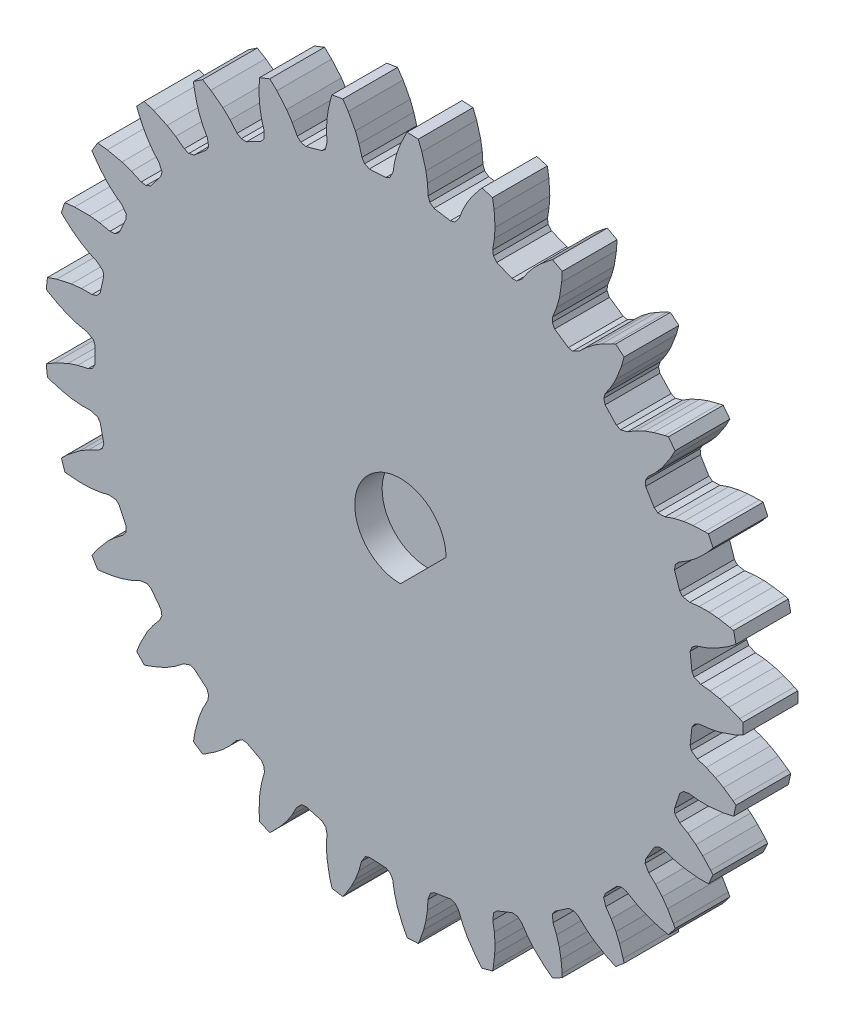
from build123d import *

# Parameters (mm, degrees)
BOSS_EXTRUDE1_DEPTH = 6
CUT_EXTRUDE1_DEPTH  = 3


with BuildPart() as part:
    # Sketch2 → Boss-Extrude1 (new body)
    with BuildSketch(Plane.XY):
        Polygon((13.434896137, 30.085511597), (12.943917266, 30.086396982), (11.264530778, 30.755525717), (10.899750384, 31.191462351), (10.826172203, 31.731935444), (11.005641062, 32.886905725), (11.077014093, 33.985331061), (10.978925225, 35.629670245), (10.806166971, 36.685335009), (9.647161448, 37.007131295), (9.375505101, 36.699837582), (8.593149777, 35.69545855), (8.032491986, 34.836488949), (7.526554726, 33.856954531), (7.15190235, 32.895155464), (6.653300303, 32.270234999), (6.173609914, 32.16555374), (4.389643649, 32.458020164), (3.939678129, 32.805347841), (3.751634426, 33.317367838), (3.678622933, 34.483916056), (3.512198324, 35.57200391), (3.062918401, 37.15681315), (2.667262419, 38.150659141), (1.466177112, 38.215780081), (1.266931005, 37.85727264), (0.718778516, 36.708192163), (0.355881666, 35.748779943), (0.072343883, 34.683384939), (-0.08679096, 33.663533013), (-0.43939654, 32.94603814), (-0.885368659, 32.740685017), (-2.690498419, 32.642813725), (-3.204609179, 32.885291788), (-3.498325689, 33.344917205), (-3.820403598, 34.468496861), (-4.216844017, 35.495369454), (-4.996307165, 36.946544832), (-5.59636044, 37.832100915), (-6.783364117, 37.637501527), (-6.900883459, 37.244543766), (-7.189202111, 36.004491571), (-7.337369367, 34.989497779), (-7.385249761, 33.888058877), (-7.321426103, 32.857841235), (-7.511547771, 32.081321216), (-7.902948459, 31.784898312), (-9.644835854, 31.301265658), (-10.199052606, 31.427556102), (-10.584708065, 31.813295365), (-11.140792385, 32.841369123), (-11.7487115, 33.759011034), (-12.821911043, 35.008697202), (-13.598303787, 35.744555759), (-14.715722862, 35.299335294), (-14.746020364, 34.890301483), (-14.76102372, 33.617261031), (-14.687533245, 32.59414565), (-14.497517417, 31.508164908), (-14.21371958, 30.515753382), (-14.232467459, 29.71651743), (-14.550995254, 29.342885151), (-16.148191565, 28.496105259), (-16.71659975, 28.500302884), (-17.176161338, 28.794119253), (-17.940250184, 29.678615527), (-18.731222373, 30.44411884), (-20.047976693, 31.433881862), (-20.964405644, 31.985634966), (-21.959990842, 31.310611437), (-21.901649827, 30.904627541), (-21.642636347, 29.65812479), (-21.350924475, 28.674727558), (-20.931897352, 27.654984228), (-20.441395409, 26.746782878), (-20.287892869, 25.962202379), (-20.518653765, 25.528831355), (-21.896475868, 24.358498712), (-22.45249735, 24.240407241), (-22.964476478, 24.42856219), (-23.900841905, 25.128122917), (-24.837882188, 25.705693548), (-26.336621316, 26.389253205), (-27.350235275, 26.731101492), (-28.17743414, 25.85783825), (-28.033182569, 25.473887626), (-27.512263434, 24.312207659), (-27.015970288, 23.414511137), (-26.387525114, 22.508687284), (-25.713254389, 21.727162595), (-25.394679039, 20.993923661), (-25.526882913, 20.52107784), (-26.620905378, 19.0819159), (-27.138541211, 18.847057158), (-27.678998304, 18.92075277), (-28.743856904, 19.402667268), (-29.78315032, 19.765298658), (-31.39379488, 20.110692459), (-32.457198385, 20.226651485), (-33.077332016, 19.195981347), (-32.853914932, 18.8520171), (-32.095447743, 17.82947878), (-31.417779438, 17.05945826), (-30.609301611, 16.309909201), (-29.782790255, 15.6916044), (-29.314038322, 15.043992468), (-29.341503469, 14.553781594), (-30.100571021, 12.91308397), (-30.555617129, 12.572439692), (-31.099281013, 12.528230043), (-32.242841183, 12.769964525), (-33.335791526, 12.900700431), (-34.983029569, 12.891778147), (-36.046499053, 12.776425796), (-36.430570691, 11.636541754), (-36.138434829, 11.348647268), (-35.177884669, 10.513063351), (-34.350528222, 9.906724137), (-33.399821266, 9.348497953), (-32.459716031, 8.922324285), (-31.862705836, 8.390620969), (-31.784148016, 7.905966758), (-32.172767499, 6.140450647), (-32.543946432, 5.709948981), (-33.065395989, 5.549901264), (-34.234186126, 5.540152496), (-35.329688252, 5.432879852), (-36.936496757, 5.07005868), (-37.95030557, 4.728788699), (-38.080356453, 3.532990463), (-37.73316176, 3.314627365), (-36.615442887, 2.705068827), (-35.677084566, 2.290762666), (-34.628602482, 1.949961393), (-33.618861644, 1.735846265), (-32.92150872, 1.344913421), (-32.740601208, 0.888477765), (-32.740601208, -0.919303262), (-33.010557051, -1.419532537), (-33.48540988, -1.687934667), (-34.624778656, -1.948710845), (-35.671608103, -2.288976088), (-37.162854492, -2.988731035), (-38.07959806, -3.539961241), (-37.949547152, -4.735759473), (-37.563528067, -4.874380767), (-36.340903772, -5.229411647), (-35.33542017, -5.432312259), (-34.238188815, -5.539753133), (-33.206026733, -5.531797936), (-32.440938527, -5.763680721), (-32.166140359, -6.170555398), (-31.777520876, -7.936071509), (-31.933630794, -8.482638228), (-32.339683303, -8.846844588), (-33.3963551, -9.346454571), (-34.345563288, -9.903801989), (-35.651518535, -10.907770947), (-36.428330949, -11.643186465), (-36.044259286, -12.783070498), (-35.637465632, -12.835468211), (-34.36710447, -12.919370583), (-33.341510881, -12.901378239), (-32.246835574, -12.770434897), (-31.240514999, -12.540781351), (-30.443466186, -12.602771498), (-30.087626618, -12.941060187), (-29.328559067, -14.581757812), (-29.363523534, -15.149105122), (-29.681789159, -15.592085826), (-30.606355179, -16.307168407), (-31.413558187, -17.055537053), (-32.473157278, -18.31677555), (-33.073715651, -19.201989168), (-32.453581998, -20.232659292), (-32.045034995, -20.196383364), (-30.78633764, -20.005234048), (-29.788589682, -19.767190049), (-28.747656222, -19.403985257), (-27.814231588, -18.963371707), (-27.022491284, -18.852570624), (-26.602248979, -19.106455323), (-25.508226515, -20.545617263), (-25.420410631, -21.107216636), (-25.636007625, -21.608258399), (-26.385236188, -22.50537711), (-27.012690101, -23.4097741), (-27.77638736, -24.869308024), (-28.17261025, -25.862928137), (-27.345411367, -26.736191362), (-26.954214218, -26.612938016), (-25.766035961, -26.15567494), (-24.842787219, -25.70870996), (-23.904268499, -25.13022677), (-23.087385703, -24.499255815), (-22.337974805, -24.220844439), (-21.872979825, -24.378453782), (-20.495157723, -25.548786424), (-20.288667661, -26.078378096), (-20.391514949, -26.614052762), (-20.930372961, -27.651259331), (-21.348738731, -28.669396065), (-21.780824521, -30.258979233), (-21.954184988, -31.31454527), (-20.958599775, -31.989568778), (-20.603044424, -31.785101203), (-19.540943159, -31.08310548), (-18.735363718, -30.448119105), (-17.94314383, -29.681406748), (-17.280999403, -28.889581889), (-16.608959532, -28.456578425), (-16.120954527, -28.510542774), (-14.523758216, -29.357322666), (-14.208249222, -29.830143519), (-14.19353778, -30.375403536), (-14.496828838, -31.504199336), (-14.686544146, -32.588468873), (-14.766814618, -34.233774142), (-14.709206518, -35.301929007), (-13.591787433, -35.747149449), (-13.288499253, -35.471028322), (-12.402137655, -34.557124493), (-11.751895514, -33.763807979), (-11.14301778, -32.844717073), (-10.666572861, -31.929063161), (-10.103327853, -31.36171437), (-9.615131395, -31.309510411), (-7.873243999, -31.793143066), (-7.463468924, -32.187084523), (-7.33188664, -32.716434139), (-7.385429192, -33.884037932), (-7.337623163, -34.983741033), (-7.062324957, -36.607835758), (-6.776441981, -37.638633717), (-5.589438299, -37.83323308), (-5.352598708, -37.498369519), (-4.68342206, -36.41529071), (-4.218921819, -35.500738656), (-3.821856685, -34.47224487), (-3.553389308, -33.475576863), (-3.125275875, -32.800411345), (-2.659715486, -32.644480078), (-0.854585726, -32.74235137), (-0.369705195, -33.038993166), (-0.127404713, -33.52768058), (0.071304833, -34.679496512), (0.354396843, -35.743212282), (0.972391088, -37.270155599), (1.47318137, -38.215397685), (2.674266676, -38.15027672), (2.833583322, -37.77232857), (3.254285063, -36.570718344), (3.511323889, -35.577694187), (3.678010099, -34.487888748), (3.725946698, -33.456809735), (3.998910448, -32.705397478), (4.420065681, -32.453030076), (6.204031945, -32.160563652), (6.741345456, -32.346035147), (7.083034436, -32.77120988), (7.52470464, -33.853380316), (8.029845565, -34.831370589), (8.961639124, -36.189764325), (9.653920315, -37.005252069), (10.812925831, -36.683455758), (10.887270063, -36.280095457), (11.039825352, -35.016139772), (11.077383913, -33.991076219), (11.005897137, -32.890917217), (10.831061495, -31.873639306), (10.936112081, -31.081115513), (11.293169407, -30.744112395), (12.972555895, -30.07498366), (13.537178204, -30.140612413), (13.962278685, -30.482393766), (14.62625754, -31.444317621), (15.32982755, -32.290852658), (16.531850793, -33.417179831), (17.383252594, -34.064781933), (18.445984511, -33.501357115), (18.431880074, -33.091445341), (18.309155595, -31.824245359), (18.125477694, -30.815073242), (17.819160575, -29.75600289), (17.429727813, -28.800092867), (17.361953185, -28.003515069), (17.638217001, -27.597634126), (19.134497468, -26.583130796), (19.700027463, -26.525848079), (20.188662219, -26.768254736), (21.043902812, -27.564953519), (21.913003755, -28.240450283), (23.329051411, -29.082045087), (24.29976322, -29.531480391), (25.216529374, -28.752772185), (25.114635777, -28.355475958), (24.72236999, -27.144284542), (24.326044202, -26.198191628), (23.799219787, -25.229730878), (23.213399348, -24.379886032), (22.975968574, -23.616501322), (23.15852109, -23.160721095), (24.401731124, -21.848280219), (24.94172525, -21.670764508), (25.471046263, -21.802461804), (26.477558495, -22.396682765), (27.471552178, -22.869555778), (29.035411432, -23.387066175), (30.080043847, -23.617319587), (30.807977284, -22.659739527), (30.623058961, -22.293635975), (29.979593791, -21.195087084), (29.389151878, -20.356311618), (28.6664539, -19.523744612), (27.911638105, -18.819702735), (27.51565319, -18.125206129), (27.595958459, -17.640838398), (28.527966957, -16.091828262), (29.017175693, -15.802379999), (29.5624325, -15.81720992), (30.673152973, -16.18116796), (31.745561353, -16.429306215), (33.384107883, -16.598534012), (34.453815046, -16.598839149), (34.958878396, -15.507162611), (34.699581919, -15.189370329), (33.835005067, -14.254830891), (33.078055428, -13.562593089), (32.193276431, -12.904849738), (31.304759617, -12.379531054), (30.768736368, -11.786396444), (30.7430394, -11.296089701), (31.320266666, -9.582940284), (31.735815154, -9.195093744), (32.271512155, -9.092362854), (33.43450482, -9.209039688), (34.535183278, -9.220840508), (36.171800475, -9.033872784), (37.216564075, -8.804215367), (37.475141137, -7.629487928), (37.153590921, -7.374866532), (36.108329042, -6.648034573), (35.220265799, -6.134702703), (34.214777066, -5.682538357), (33.234105293, -5.360506182), (32.583107561, -4.896467883), (32.452609918, -4.423148328), (32.648065447, -2.625964593), (32.970523101, -2.157855048), (33.471611698, -1.942366929), (34.632496312, -1.806306878), (35.709978346, -1.581218469), (37.268139808, -1.046797627), (38.239107814, -0.597916203), (38.239107639, 0.604933271), (37.870338971, 0.784477986), (36.693267342, 1.269616598), (35.715615343, 1.580039698), (34.636432407, 1.805482326), (33.609460795, 1.909170114), (32.873928508, 2.222414178), (32.64473211, 2.656614646), (32.449276599, 4.453798384), (32.663565652, 4.980282654), (33.106615497, 5.298452022), (34.21111038, 5.680886952), (35.215014125, 6.132339718), (36.621861945, 6.989224767), (37.473633054, 7.636341052), (37.215055979, 8.811068488), (36.816312157, 8.907141173), (35.562469348, 9.127901909), (34.540942518, 9.220901208), (33.438526778, 9.209080682), (32.413275383, 9.089575767), (31.627601218, 9.23737866), (31.310423038, 9.612157312), (30.73319579, 11.325306735), (30.829296327, 11.885547907), (31.193590905, 12.291521273), (32.190051106, 12.902448838), (33.073435139, 13.559156519), (34.263186683, 14.698438767), (34.955932984, 15.513531443), (34.450869624, 16.605207977), (34.040795422, 16.613316401), (32.768809729, 16.559376732), (31.751173529, 16.430603688), (30.67707272, 16.182072722), (29.701481156, 15.844963022), (28.902402364, 15.820413644), (28.512073302, 16.118246247), (27.58006482, 17.667256393), (27.553483289, 18.235058213), (27.821988589, 18.709852712), (28.663820737, 19.520706618), (29.385379003, 20.351962293), (30.30240281, 21.720370168), (30.803732257, 22.665326408), (30.075798812, 23.622906458), (29.673568846, 23.54267148), (28.442916905, 23.216553567), (27.476754872, 22.872029463), (26.481192755, 22.398409089), (25.6008786, 21.859457479), (24.825759216, 21.663703732), (24.380530625, 21.870663963), (23.137320591, 23.183104839), (22.989299914, 23.731917525), (23.149460927, 24.253332295), (23.797301885, 25.226197915), (24.323295122, 26.193132992), (24.924712179, 27.726681263), (25.211183163, 28.757315963), (24.294416992, 29.53602415), (23.918839088, 29.371197469), (22.787064818, 28.788150222), (21.917553614, 28.243984622), (21.047081566, 27.567420803), (20.303207332, 26.85182806), (19.588291078, 26.494023172), (19.108981351, 26.600433802), (17.612700884, 27.614937131), (17.350162344, 28.119098811), (17.394490119, 28.662753077), (17.818047565, 29.752140296), (18.123880913, 30.809541965), (18.381569626, 32.43652362), (18.439787082, 33.504645447), (17.377055154, 34.068070242), (17.045690916, 33.82635897), (16.065714823, 33.01364503), (15.333511827, 32.295282513), (14.628832153, 31.44741062), (14.056180572, 30.588637067), align=None)
    extrude(amount=BOSS_EXTRUDE1_DEPTH)

    # Sketch3 → Revolve1 (revolve)
    with BuildSketch(Plane(origin=(-2.4856e-05, 0, 0), x_dir=(0, 0, -1), z_dir=(1, 0, 0))):
        Polygon((0, 0), (5, 0), (2, 3), (0, 3), align=None)
    revolve(axis=Axis((-2.4856e-05, 0, 0), (0, 0, -1)))

    # Sketch5 → Cut-Extrude1 (cut)
    with BuildSketch(Plane.XY.offset(6)):
        with BuildLine():
            Line((0.712987086, -5), (5.712987086, 0))
            ThreePointArc((5.712987086, 0), (-2.82254682, 3.535533906), (0.712987086, -5))
        make_face()
    extrude(amount=-CUT_EXTRUDE1_DEPTH, mode=Mode.SUBTRACT)


solid = part.part
